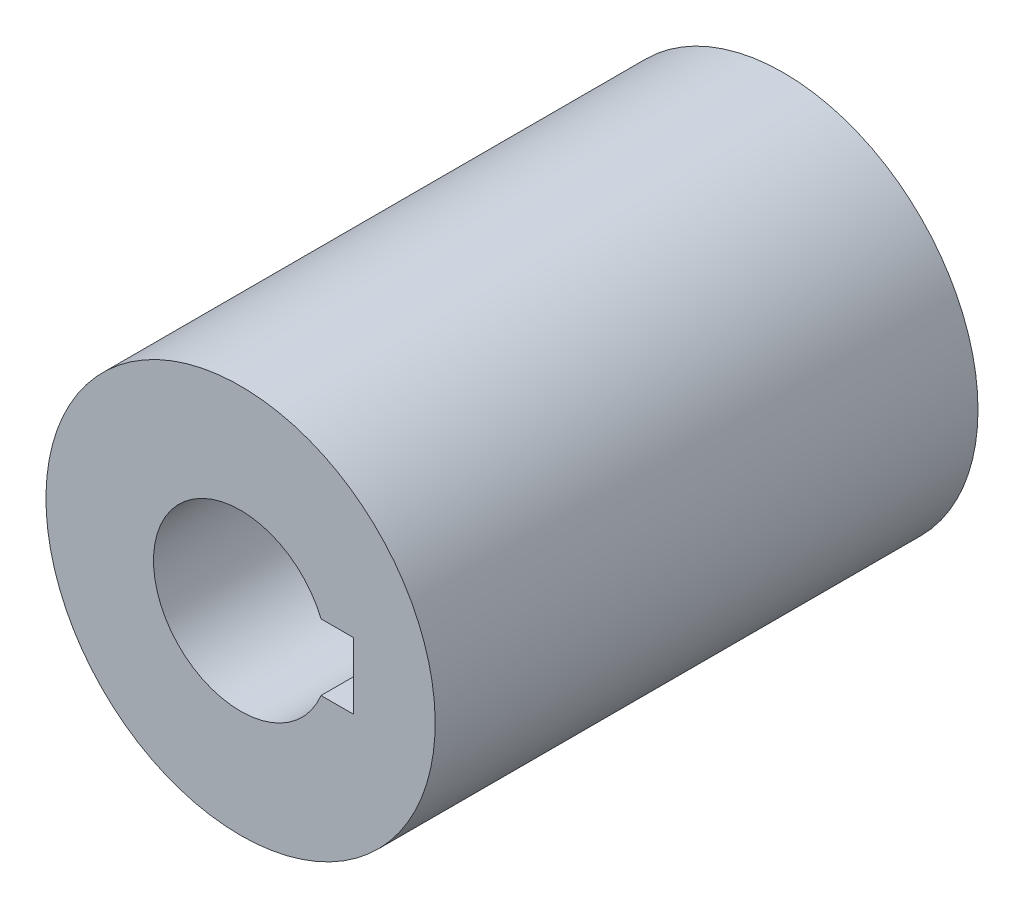
from build123d import *
from build123d.topology import SkipClean

# Parameters (mm, degrees)
SKETCH2_R              = 9.5
BOSS_EXTRUDE1_DEPTH    = 21
SKETCH3_R              = 4.25
BOSS_EXTRUDE2_DEPTH    = 5
BOSS_EXTRUDE3_START    = 10
SKETCH4_R              = 9.5
BOSS_EXTRUDE3_DEPTH    = 10
CUT_EXTRUDE1_START     = -7.5
CUT_EXTRUDE1_OUTLINE_R = 9.5
CUT_EXTRUDE1_DEPTH     = 7.5
SKETCH6_R              = 9.5
BOSS_EXTRUDE4_DEPTH    = 3


# Read off the part's stored shape, not the designer's step: Cut-Extrude1
with BuildPart() as part:
    # Sketch2 → Boss-Extrude1 (new body)
    with BuildSketch(Plane.XY):
        Circle(SKETCH2_R)
        Polygon((-6.5, -3.75277675), (0, -7.505553499), (6.5, -3.75277675), (6.5, 3.75277675), (0, 7.505553499), (-6.5, 3.75277675), align=None, mode=Mode.SUBTRACT)
    extrude(amount=-BOSS_EXTRUDE1_DEPTH)

    # Sketch3 → Boss-Extrude2 (add)
    with BuildSketch(Plane.XY):
        Polygon((-6.5, -3.75277675), (0, -7.505553499), (6.5, -3.75277675), (6.5, 3.75277675), (0, 7.505553499), (-6.5, 3.75277675), align=None)
        Circle(SKETCH3_R, mode=Mode.SUBTRACT)
    extrude(amount=-BOSS_EXTRUDE2_DEPTH)

    # Sketch4 → Boss-Extrude3 (add)
    with BuildSketch(Plane.XY.offset(BOSS_EXTRUDE3_START)):
        with Locations(Location((0, 0, 0), (0, 0, 270))):
            Circle(SKETCH4_R)
        with BuildLine():
            ThreePointArc((3.929134765, -1.62), (-4.25, 0), (3.929134765, 1.62))
            Line((3.929134765, 1.62), (5.52, 1.62))
            Line((5.52, 1.62), (5.52, -1.62))
            Line((5.52, -1.62), (3.929134765, -1.62))
        make_face(mode=Mode.SUBTRACT)
    extrude(amount=-BOSS_EXTRUDE3_DEPTH)

    # Cut-Extrude1 outline → Cut-Extrude1 (cut)
    with BuildSketch(Plane(origin=(0, 0, -21), x_dir=(-1, 0, 0), z_dir=(0, 0, -1)).offset(CUT_EXTRUDE1_START)):
        Circle(CUT_EXTRUDE1_OUTLINE_R)
        Polygon((6.5, 3.75277675), (6.5, -3.75277675), (0, -7.505553499), (-6.5, -3.75277675), (-6.5, 3.75277675), (0, 7.505553499), align=None, mode=Mode.SUBTRACT)
    extrude(amount=CUT_EXTRUDE1_DEPTH, mode=Mode.SUBTRACT)

    # Sketch6 → Boss-Extrude4 (add)
    with SkipClean():  # the faces are left unmerged after this step: merging them gives an invalid solid
        with BuildSketch(Plane(origin=(0, 0, -13.5), x_dir=(-1, 0, 0), z_dir=(0, 0, -1))):
            with Locations(Location((0, 0, 0), (0, 0, 270))):
                Circle(SKETCH6_R)
            Polygon((6.5, 3.75277675), (6.5, -3.75277675), (0, -7.505553499), (-6.5, -3.75277675), (-6.5, 3.75277675), (0, 7.505553499), align=None, mode=Mode.SUBTRACT)
        extrude(amount=BOSS_EXTRUDE4_DEPTH)
    add(part.part.scale(1), mode=Mode.REPLACE)  # the faces are merged on a copy


solid = part.part
